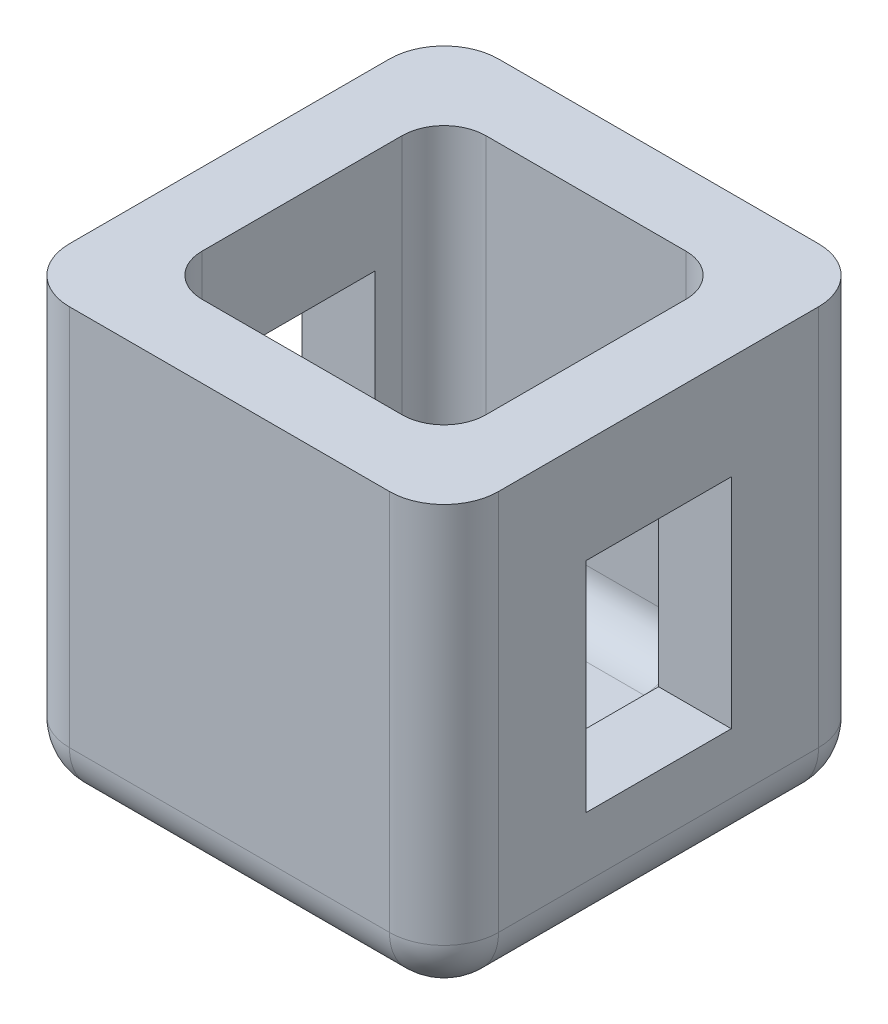
from build123d import *

# Parameters (mm, degrees)
SKETCH1_W           = 236
SKETCH1_H           = 236
BOSS_EXTRUDE1_DEPTH = 240
SHELL1_T            = -40
FILLET1_R           = 23
FILLET2_R           = 30
SKETCH3_W           = 80
SKETCH3_H           = 120
CUT_EXTRUDE2_DEPTH  = 240


with BuildPart() as part:
    # Sketch1 → Boss-Extrude1 (new body)
    with BuildSketch(Plane(origin=(0, 0, 0), x_dir=(1, 0, 0), z_dir=(0, 1, 0))):
        with Locations((2.531496063, -48.329724409)):
            Rectangle(SKETCH1_W, SKETCH1_H)
    extrude(amount=BOSS_EXTRUDE1_DEPTH)

    # Shell1
    shell1_openings = [part.faces().sort_by_distance(p)[0] for p in [
        (2.531496063, 240, 48.329724409),
    ]]
    offset(amount=SHELL1_T, openings=shell1_openings, kind=Kind.INTERSECTION)

    # Fillet1
    fillet1_edges = [part.edges().sort_by_distance(p)[0] for p in [
        (2.531496063, 40, -29.670275591),
        (80.531496063, 40, 48.329724409),
        (2.531496063, 40, 126.329724409),
        (-75.468503937, 40, 48.329724409),
        (80.531496063, 140, -29.670275591),
        (80.531496063, 140, 126.329724409),
        (-75.468503937, 140, 126.329724409),
        (-75.468503937, 140, -29.670275591),
    ]]
    fillet(fillet1_edges, radius=FILLET1_R)

    # Fillet2
    fillet2_edges = [part.edges().sort_by_distance(p)[0] for p in [
        (2.531496063, 0, 166.329724409),
        (120.531496063, 0, 48.329724409),
        (2.531496063, 0, -69.670275591),
        (-115.468503937, 0, 48.329724409),
        (-115.468503937, 120, -69.670275591),
        (120.531496063, 120, -69.670275591),
        (-115.468503937, 120, 166.329724409),
        (120.531496063, 120, 166.329724409),
    ]]
    fillet(fillet2_edges, radius=FILLET2_R)

    # Sketch3 → Cut-Extrude2 (cut)
    with BuildSketch(Plane(origin=(120.531496063, 0, 0), x_dir=(0, 0, -1), z_dir=(1, 0, 0))):
        with Locations((-48.329724409, 123)):
            Rectangle(SKETCH3_W, SKETCH3_H)
    extrude(amount=-CUT_EXTRUDE2_DEPTH, mode=Mode.SUBTRACT)


solid = part.part
